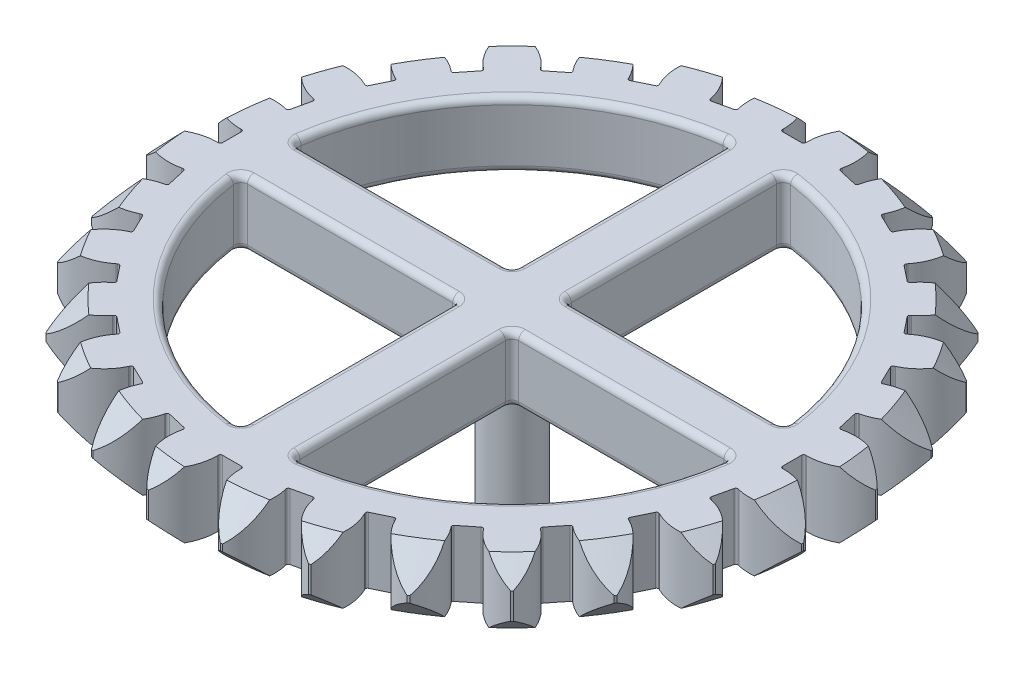
from build123d import *

# Parameters (mm, degrees)
SKETCH1_R             = 4
BOSS_EXTRUDE1_DEPTH   = 10
BOSS_EXTRUDE2_DEPTH   = 10
CUT_EXTRUDE2_REACH    = 78.425
FILLET1_R             = 1
SKETCH4_R             = 2
BOSS_EXTRUDE3_DEPTH   = 10
CUT_REVOLVE2_ANGLE    = 15
CIRPATTERN1_COUNT     = 14
MIRROR1_COPY_1_ANGLE  = 15
MIRROR1_COPY_2_ANGLE  = 15
MIRROR1_COPY_3_ANGLE  = 15
MIRROR1_COPY_4_ANGLE  = 15
MIRROR1_COPY_5_ANGLE  = 15
MIRROR1_COPY_6_ANGLE  = 15
MIRROR1_COPY_7_ANGLE  = 15
MIRROR1_COPY_8_ANGLE  = 15
MIRROR1_COPY_9_ANGLE  = 15
MIRROR1_COPY_10_ANGLE = 15
MIRROR1_COPY_11_ANGLE = 15
MIRROR1_COPY_12_ANGLE = 15
MIRROR1_COPY_13_ANGLE = 15


with BuildPart() as part:
    # Sketch1 → Boss-Extrude1 (new, symmetric)
    with BuildSketch(Plane(origin=(0, 0, 0), x_dir=(1, 0, 0), z_dir=(0, 1, 0))):
        Circle(SKETCH1_R)
        with BuildLine():
            Line((-1.322875656, 1.5), (1.322875656, 1.5))
            ThreePointArc((1.322875656, 1.5), (0, -2), (-1.322875656, 1.5))
        make_face(mode=Mode.SUBTRACT)
    extrude(amount=BOSS_EXTRUDE1_DEPTH, both=True)

    # Sketch2 → Boss-Extrude2 (add)
    with BuildSketch(Plane(origin=(0, 10, 0), x_dir=(1, 0, 0), z_dir=(0, 1, 0))):
        with BuildLine():
            Line((1.45, 42.5), (-1.45, 42.5))
            ThreePointArc((-1.45, 42.5), (-1.662132034, 42.587867966), (-1.75, 42.8))
            Line((-1.75, 42.8), (-1.75, 42.964374777))
            ThreePointArc((-1.75, 42.964374777), (-2.73252906, 46.805611766), (-5.438775402, 49.703317013))
            ThreePointArc((-5.438775402, 49.703317013), (-5.598223805, 49.685610495), (-5.757614575, 49.667392466))
            ThreePointArc((-5.757614575, 49.667392466), (-7.751209593, 46.240142276), (-7.854348956, 42.276579834))
            Line((-7.854348956, 42.276579834), (-7.817772127, 42.116326276))
            ThreePointArc((-7.817772127, 42.116326276), (-7.856233241, 41.889960373), (-8.04349422, 41.757091622))
            Line((-8.04349422, 41.757091622), (-10.870785166, 41.111780913))
            ThreePointArc((-10.870785166, 41.111780913), (-11.097151069, 41.150242027), (-11.23001982, 41.337503007))
            Line((-11.23001982, 41.337503007), (-11.266596649, 41.497756565))
            ThreePointArc((-11.266596649, 41.497756565), (-13.079247296, 45.024052439), (-16.36244247, 47.246909702))
            ThreePointArc((-16.36244247, 47.246909702), (-16.513953098, 47.194166515), (-16.665293716, 47.140937468))
            ThreePointArc((-16.665293716, 47.140937468), (-17.846270231, 43.35599897), (-17.064848058, 39.468860647))
            Line((-17.064848058, 39.468860647), (-16.993528515, 39.32076409))
            ThreePointArc((-16.993528515, 39.32076409), (-16.980654177, 39.091515249), (-17.133654054, 38.920308308))
            Line((-17.133654054, 38.920308308), (-19.746463771, 37.662045464))
            ThreePointArc((-19.746463771, 37.662045464), (-19.975712611, 37.649171125), (-20.146919553, 37.802171003))
            Line((-20.146919553, 37.802171003), (-20.218239096, 37.95026756))
            ThreePointArc((-20.218239096, 37.95026756), (-22.770117459, 40.984799119), (-26.465628349, 42.421345053))
            ThreePointArc((-26.465628349, 42.421345053), (-26.601603826, 42.336209961), (-26.737305441, 42.250639022))
            ThreePointArc((-26.737305441, 42.250639022), (-27.04644436, 38.297804837), (-25.419644423, 34.682007979))
            Line((-25.419644423, 34.682007979), (-25.317158425, 34.553494603))
            ThreePointArc((-25.317158425, 34.553494603), (-25.253594207, 34.332858319), (-25.364660929, 34.131898218))
            Line((-25.364660929, 34.131898218), (-27.631972229, 32.323777792))
            ThreePointArc((-27.631972229, 32.323777792), (-27.852608512, 32.260213574), (-28.053568614, 32.371280296))
            Line((-28.053568614, 32.371280296), (-28.156054611, 32.499793672))
            ThreePointArc((-28.156054611, 32.499793672), (-31.319198852, 34.890396833), (-35.241717111, 35.468597027))
            ThreePointArc((-35.241717111, 35.468597027), (-35.355339059, 35.355339059), (-35.468597027, 35.241717111))
            ThreePointArc((-35.468597027, 35.241717111), (-34.890396833, 31.319198852), (-32.499793672, 28.156054611))
            Line((-32.499793672, 28.156054611), (-32.371280296, 28.053568614))
            ThreePointArc((-32.371280296, 28.053568614), (-32.260213574, 27.852608512), (-32.323777792, 27.631972229))
            Line((-32.323777792, 27.631972229), (-34.131898218, 25.364660929))
            ThreePointArc((-34.131898218, 25.364660929), (-34.332858319, 25.253594207), (-34.553494603, 25.317158425))
            Line((-34.553494603, 25.317158425), (-34.682007979, 25.419644423))
            ThreePointArc((-34.682007979, 25.419644423), (-38.297804837, 27.04644436), (-42.250639022, 26.737305441))
            ThreePointArc((-42.250639022, 26.737305441), (-42.336209961, 26.601603826), (-42.421345053, 26.465628349))
            ThreePointArc((-42.421345053, 26.465628349), (-40.984799119, 22.770117459), (-37.95026756, 20.218239096))
            Line((-37.95026756, 20.218239096), (-37.802171003, 20.146919553))
            ThreePointArc((-37.802171003, 20.146919553), (-37.649171125, 19.975712611), (-37.662045464, 19.746463771))
            Line((-37.662045464, 19.746463771), (-38.920308308, 17.133654054))
            ThreePointArc((-38.920308308, 17.133654054), (-39.091515249, 16.980654177), (-39.32076409, 16.993528515))
            Line((-39.32076409, 16.993528515), (-39.468860647, 17.064848058))
            ThreePointArc((-39.468860647, 17.064848058), (-43.35599897, 17.846270231), (-47.140937468, 16.665293716))
            ThreePointArc((-47.140937468, 16.665293716), (-47.194166515, 16.513953098), (-47.246909702, 16.36244247))
            ThreePointArc((-47.246909702, 16.36244247), (-45.024052439, 13.079247296), (-41.497756565, 11.266596649))
            Line((-41.497756565, 11.266596649), (-41.337503007, 11.23001982))
            ThreePointArc((-41.337503007, 11.23001982), (-41.150242027, 11.097151069), (-41.111780913, 10.870785166))
            Line((-41.111780913, 10.870785166), (-41.757091622, 8.04349422))
            ThreePointArc((-41.757091622, 8.04349422), (-41.889960373, 7.856233241), (-42.116326276, 7.817772127))
            Line((-42.116326276, 7.817772127), (-42.276579834, 7.854348956))
            ThreePointArc((-42.276579834, 7.854348956), (-46.240142276, 7.751209593), (-49.667392466, 5.757614575))
            ThreePointArc((-49.667392466, 5.757614575), (-49.685610495, 5.598223805), (-49.703317013, 5.438775402))
            ThreePointArc((-49.703317013, 5.438775402), (-46.805611766, 2.73252906), (-42.964374777, 1.75))
            Line((-42.964374777, 1.75), (-42.8, 1.75))
            ThreePointArc((-42.8, 1.75), (-42.587867966, 1.662132034), (-42.5, 1.45))
            Line((-42.5, 1.45), (-42.5, -1.45))
            ThreePointArc((-42.5, -1.45), (-42.587867966, -1.662132034), (-42.8, -1.75))
            Line((-42.8, -1.75), (-42.964374777, -1.75))
            ThreePointArc((-42.964374777, -1.75), (-46.805611766, -2.73252906), (-49.703317013, -5.438775402))
            ThreePointArc((-49.703317013, -5.438775402), (-49.685610495, -5.598223805), (-49.667392466, -5.757614575))
            ThreePointArc((-49.667392466, -5.757614575), (-46.240142276, -7.751209593), (-42.276579834, -7.854348956))
            Line((-42.276579834, -7.854348956), (-42.116326276, -7.817772127))
            ThreePointArc((-42.116326276, -7.817772127), (-41.889960373, -7.856233241), (-41.757091622, -8.04349422))
            Line((-41.757091622, -8.04349422), (-41.111780913, -10.870785166))
            ThreePointArc((-41.111780913, -10.870785166), (-41.150242027, -11.097151069), (-41.337503007, -11.23001982))
            Line((-41.337503007, -11.23001982), (-41.497756565, -11.266596649))
            ThreePointArc((-41.497756565, -11.266596649), (-45.024052439, -13.079247296), (-47.246909702, -16.36244247))
            ThreePointArc((-47.246909702, -16.36244247), (-47.194166515, -16.513953098), (-47.140937468, -16.665293716))
            ThreePointArc((-47.140937468, -16.665293716), (-43.35599897, -17.846270231), (-39.468860647, -17.064848058))
            Line((-39.468860647, -17.064848058), (-39.32076409, -16.993528515))
            ThreePointArc((-39.32076409, -16.993528515), (-39.091515249, -16.980654177), (-38.920308308, -17.133654054))
            Line((-38.920308308, -17.133654054), (-37.662045464, -19.746463771))
            ThreePointArc((-37.662045464, -19.746463771), (-37.649171125, -19.975712611), (-37.802171003, -20.146919553))
            Line((-37.802171003, -20.146919553), (-37.95026756, -20.218239096))
            ThreePointArc((-37.95026756, -20.218239096), (-40.984799119, -22.770117459), (-42.421345053, -26.465628349))
            ThreePointArc((-42.421345053, -26.465628349), (-42.336209961, -26.601603826), (-42.250639022, -26.737305441))
            ThreePointArc((-42.250639022, -26.737305441), (-38.297804837, -27.04644436), (-34.682007979, -25.419644423))
            Line((-34.682007979, -25.419644423), (-34.553494603, -25.317158425))
            ThreePointArc((-34.553494603, -25.317158425), (-34.332858319, -25.253594207), (-34.131898218, -25.364660929))
            Line((-34.131898218, -25.364660929), (-32.323777792, -27.631972229))
            ThreePointArc((-32.323777792, -27.631972229), (-32.260213574, -27.852608512), (-32.371280296, -28.053568614))
            Line((-32.371280296, -28.053568614), (-32.499793672, -28.156054611))
            ThreePointArc((-32.499793672, -28.156054611), (-34.890396833, -31.319198852), (-35.468597027, -35.241717111))
            ThreePointArc((-35.468597027, -35.241717111), (-35.355339059, -35.355339059), (-35.241717111, -35.468597027))
            ThreePointArc((-35.241717111, -35.468597027), (-31.319198852, -34.890396833), (-28.156054611, -32.499793672))
            Line((-28.156054611, -32.499793672), (-28.053568614, -32.371280296))
            ThreePointArc((-28.053568614, -32.371280296), (-27.852608512, -32.260213574), (-27.631972229, -32.323777792))
            Line((-27.631972229, -32.323777792), (-25.364660929, -34.131898218))
            ThreePointArc((-25.364660929, -34.131898218), (-25.253594207, -34.332858319), (-25.317158425, -34.553494603))
            Line((-25.317158425, -34.553494603), (-25.419644423, -34.682007979))
            ThreePointArc((-25.419644423, -34.682007979), (-27.04644436, -38.297804837), (-26.737305441, -42.250639022))
            ThreePointArc((-26.737305441, -42.250639022), (-26.601603826, -42.336209961), (-26.465628349, -42.421345053))
            ThreePointArc((-26.465628349, -42.421345053), (-22.770117459, -40.984799119), (-20.218239096, -37.95026756))
            Line((-20.218239096, -37.95026756), (-20.146919553, -37.802171003))
            ThreePointArc((-20.146919553, -37.802171003), (-19.975712611, -37.649171125), (-19.746463771, -37.662045464))
            Line((-19.746463771, -37.662045464), (-17.133654054, -38.920308308))
            ThreePointArc((-17.133654054, -38.920308308), (-16.980654177, -39.091515249), (-16.993528515, -39.32076409))
            Line((-16.993528515, -39.32076409), (-17.064848058, -39.468860647))
            ThreePointArc((-17.064848058, -39.468860647), (-17.846270231, -43.35599897), (-16.665293716, -47.140937468))
            ThreePointArc((-16.665293716, -47.140937468), (-16.513953098, -47.194166515), (-16.36244247, -47.246909702))
            ThreePointArc((-16.36244247, -47.246909702), (-13.079247296, -45.024052439), (-11.266596649, -41.497756565))
            Line((-11.266596649, -41.497756565), (-11.23001982, -41.337503007))
            ThreePointArc((-11.23001982, -41.337503007), (-11.097151069, -41.150242027), (-10.870785166, -41.111780913))
            Line((-10.870785166, -41.111780913), (-8.04349422, -41.757091622))
            ThreePointArc((-8.04349422, -41.757091622), (-7.856233241, -41.889960373), (-7.817772127, -42.116326276))
            Line((-7.817772127, -42.116326276), (-7.854348956, -42.276579834))
            ThreePointArc((-7.854348956, -42.276579834), (-7.751209593, -46.240142276), (-5.757614575, -49.667392466))
            ThreePointArc((-5.757614575, -49.667392466), (-5.598223805, -49.685610495), (-5.438775402, -49.703317013))
            ThreePointArc((-5.438775402, -49.703317013), (-2.73252906, -46.805611766), (-1.75, -42.964374777))
            Line((-1.75, -42.964374777), (-1.75, -42.8))
            ThreePointArc((-1.75, -42.8), (-1.662132034, -42.587867966), (-1.45, -42.5))
            Line((-1.45, -42.5), (1.45, -42.5))
            ThreePointArc((1.45, -42.5), (1.662132034, -42.587867966), (1.75, -42.8))
            Line((1.75, -42.8), (1.75, -42.964374777))
            ThreePointArc((1.75, -42.964374777), (2.73252906, -46.805611766), (5.438775402, -49.703317013))
            ThreePointArc((5.438775402, -49.703317013), (5.598223805, -49.685610495), (5.757614575, -49.667392466))
            ThreePointArc((5.757614575, -49.667392466), (7.751209593, -46.240142276), (7.854348956, -42.276579834))
            Line((7.854348956, -42.276579834), (7.817772127, -42.116326276))
            ThreePointArc((7.817772127, -42.116326276), (7.856233241, -41.889960373), (8.04349422, -41.757091622))
            Line((8.04349422, -41.757091622), (10.870785166, -41.111780913))
            ThreePointArc((10.870785166, -41.111780913), (11.097151069, -41.150242027), (11.23001982, -41.337503007))
            Line((11.23001982, -41.337503007), (11.266596649, -41.497756565))
            ThreePointArc((11.266596649, -41.497756565), (13.079247296, -45.024052439), (16.36244247, -47.246909702))
            ThreePointArc((16.36244247, -47.246909702), (16.513953098, -47.194166515), (16.665293716, -47.140937468))
            ThreePointArc((16.665293716, -47.140937468), (17.846270231, -43.35599897), (17.064848058, -39.468860647))
            Line((17.064848058, -39.468860647), (16.993528515, -39.32076409))
            ThreePointArc((16.993528515, -39.32076409), (16.980654177, -39.091515249), (17.133654054, -38.920308308))
            Line((17.133654054, -38.920308308), (19.746463771, -37.662045464))
            ThreePointArc((19.746463771, -37.662045464), (19.975712611, -37.649171125), (20.146919553, -37.802171003))
            Line((20.146919553, -37.802171003), (20.218239096, -37.95026756))
            ThreePointArc((20.218239096, -37.95026756), (22.770117459, -40.984799119), (26.465628349, -42.421345053))
            ThreePointArc((26.465628349, -42.421345053), (26.601603826, -42.336209961), (26.737305441, -42.250639022))
            ThreePointArc((26.737305441, -42.250639022), (27.04644436, -38.297804837), (25.419644423, -34.682007979))
            Line((25.419644423, -34.682007979), (25.317158425, -34.553494603))
            ThreePointArc((25.317158425, -34.553494603), (25.253594207, -34.332858319), (25.364660929, -34.131898218))
            Line((25.364660929, -34.131898218), (27.631972229, -32.323777792))
            ThreePointArc((27.631972229, -32.323777792), (27.852608512, -32.260213574), (28.053568614, -32.371280296))
            Line((28.053568614, -32.371280296), (28.156054611, -32.499793672))
            ThreePointArc((28.156054611, -32.499793672), (31.319198852, -34.890396833), (35.241717111, -35.468597027))
            ThreePointArc((35.241717111, -35.468597027), (35.355339059, -35.355339059), (35.468597027, -35.241717111))
            ThreePointArc((35.468597027, -35.241717111), (34.890396833, -31.319198852), (32.499793672, -28.156054611))
            Line((32.499793672, -28.156054611), (32.371280296, -28.053568614))
            ThreePointArc((32.371280296, -28.053568614), (32.260213574, -27.852608512), (32.323777792, -27.631972229))
            Line((32.323777792, -27.631972229), (34.131898218, -25.364660929))
            ThreePointArc((34.131898218, -25.364660929), (34.332858319, -25.253594207), (34.553494603, -25.317158425))
            Line((34.553494603, -25.317158425), (34.682007979, -25.419644423))
            ThreePointArc((34.682007979, -25.419644423), (38.297804837, -27.04644436), (42.250639022, -26.737305441))
            ThreePointArc((42.250639022, -26.737305441), (42.336209961, -26.601603826), (42.421345053, -26.465628349))
            ThreePointArc((42.421345053, -26.465628349), (40.984799119, -22.770117459), (37.95026756, -20.218239096))
            Line((37.95026756, -20.218239096), (37.802171003, -20.146919553))
            ThreePointArc((37.802171003, -20.146919553), (37.649171125, -19.975712611), (37.662045464, -19.746463771))
            Line((37.662045464, -19.746463771), (38.920308308, -17.133654054))
            ThreePointArc((38.920308308, -17.133654054), (39.091515249, -16.980654177), (39.32076409, -16.993528515))
            Line((39.32076409, -16.993528515), (39.468860647, -17.064848058))
            ThreePointArc((39.468860647, -17.064848058), (43.35599897, -17.846270231), (47.140937468, -16.665293716))
            ThreePointArc((47.140937468, -16.665293716), (47.194166515, -16.513953098), (47.246909702, -16.36244247))
            ThreePointArc((47.246909702, -16.36244247), (45.024052439, -13.079247296), (41.497756565, -11.266596649))
            Line((41.497756565, -11.266596649), (41.337503007, -11.23001982))
            ThreePointArc((41.337503007, -11.23001982), (41.150242027, -11.097151069), (41.111780913, -10.870785166))
            Line((41.111780913, -10.870785166), (41.757091622, -8.04349422))
            ThreePointArc((41.757091622, -8.04349422), (41.889960373, -7.856233241), (42.116326276, -7.817772127))
            Line((42.116326276, -7.817772127), (42.276579834, -7.854348956))
            ThreePointArc((42.276579834, -7.854348956), (46.240142276, -7.751209593), (49.667392466, -5.757614575))
            ThreePointArc((49.667392466, -5.757614575), (49.685610495, -5.598223805), (49.703317013, -5.438775402))
            ThreePointArc((49.703317013, -5.438775402), (46.805611766, -2.73252906), (42.964374777, -1.75))
            Line((42.964374777, -1.75), (42.8, -1.75))
            ThreePointArc((42.8, -1.75), (42.587867966, -1.662132034), (42.5, -1.45))
            Line((42.5, -1.45), (42.5, 1.45))
            ThreePointArc((42.5, 1.45), (42.587867966, 1.662132034), (42.8, 1.75))
            Line((42.8, 1.75), (42.964374777, 1.75))
            ThreePointArc((42.964374777, 1.75), (46.805611766, 2.73252906), (49.703317013, 5.438775402))
            ThreePointArc((49.703317013, 5.438775402), (49.685610495, 5.598223805), (49.667392466, 5.757614575))
            ThreePointArc((49.667392466, 5.757614575), (46.240142276, 7.751209593), (42.276579834, 7.854348956))
            Line((42.276579834, 7.854348956), (42.116326276, 7.817772127))
            ThreePointArc((42.116326276, 7.817772127), (41.889960373, 7.856233241), (41.757091622, 8.04349422))
            Line((41.757091622, 8.04349422), (41.111780913, 10.870785166))
            ThreePointArc((41.111780913, 10.870785166), (41.150242027, 11.097151069), (41.337503007, 11.23001982))
            Line((41.337503007, 11.23001982), (41.497756565, 11.266596649))
            ThreePointArc((41.497756565, 11.266596649), (45.024052439, 13.079247296), (47.246909702, 16.36244247))
            ThreePointArc((47.246909702, 16.36244247), (47.194166515, 16.513953098), (47.140937468, 16.665293716))
            ThreePointArc((47.140937468, 16.665293716), (43.35599897, 17.846270231), (39.468860647, 17.064848058))
            Line((39.468860647, 17.064848058), (39.32076409, 16.993528515))
            ThreePointArc((39.32076409, 16.993528515), (39.091515249, 16.980654177), (38.920308308, 17.133654054))
            Line((38.920308308, 17.133654054), (37.662045464, 19.746463771))
            ThreePointArc((37.662045464, 19.746463771), (37.649171125, 19.975712611), (37.802171003, 20.146919553))
            Line((37.802171003, 20.146919553), (37.95026756, 20.218239096))
            ThreePointArc((37.95026756, 20.218239096), (40.984799119, 22.770117459), (42.421345053, 26.465628349))
            ThreePointArc((42.421345053, 26.465628349), (42.336209961, 26.601603826), (42.250639022, 26.737305441))
            ThreePointArc((42.250639022, 26.737305441), (38.297804837, 27.04644436), (34.682007979, 25.419644423))
            Line((34.682007979, 25.419644423), (34.553494603, 25.317158425))
            ThreePointArc((34.553494603, 25.317158425), (34.332858319, 25.253594207), (34.131898218, 25.364660929))
            Line((34.131898218, 25.364660929), (32.323777792, 27.631972229))
            ThreePointArc((32.323777792, 27.631972229), (32.260213574, 27.852608512), (32.371280296, 28.053568614))
            Line((32.371280296, 28.053568614), (32.499793672, 28.156054611))
            ThreePointArc((32.499793672, 28.156054611), (34.890396833, 31.319198852), (35.468597027, 35.241717111))
            ThreePointArc((35.468597027, 35.241717111), (35.355339059, 35.355339059), (35.241717111, 35.468597027))
            ThreePointArc((35.241717111, 35.468597027), (31.319198852, 34.890396833), (28.156054611, 32.499793672))
            Line((28.156054611, 32.499793672), (28.053568614, 32.371280296))
            ThreePointArc((28.053568614, 32.371280296), (27.852608512, 32.260213574), (27.631972229, 32.323777792))
            Line((27.631972229, 32.323777792), (25.364660929, 34.131898218))
            ThreePointArc((25.364660929, 34.131898218), (25.253594207, 34.332858319), (25.317158425, 34.553494603))
            Line((25.317158425, 34.553494603), (25.419644423, 34.682007979))
            ThreePointArc((25.419644423, 34.682007979), (27.04644436, 38.297804837), (26.737305441, 42.250639022))
            ThreePointArc((26.737305441, 42.250639022), (26.601603826, 42.336209961), (26.465628349, 42.421345053))
            ThreePointArc((26.465628349, 42.421345053), (22.770117459, 40.984799119), (20.218239096, 37.95026756))
            Line((20.218239096, 37.95026756), (20.146919553, 37.802171003))
            ThreePointArc((20.146919553, 37.802171003), (19.975712611, 37.649171125), (19.746463771, 37.662045464))
            Line((19.746463771, 37.662045464), (17.133654054, 38.920308308))
            ThreePointArc((17.133654054, 38.920308308), (16.980654177, 39.091515249), (16.993528515, 39.32076409))
            Line((16.993528515, 39.32076409), (17.064848058, 39.468860647))
            ThreePointArc((17.064848058, 39.468860647), (17.846270231, 43.35599897), (16.665293716, 47.140937468))
            ThreePointArc((16.665293716, 47.140937468), (16.513953098, 47.194166515), (16.36244247, 47.246909702))
            ThreePointArc((16.36244247, 47.246909702), (13.079247296, 45.024052439), (11.266596649, 41.497756565))
            Line((11.266596649, 41.497756565), (11.23001982, 41.337503007))
            ThreePointArc((11.23001982, 41.337503007), (11.097151069, 41.150242027), (10.870785166, 41.111780913))
            Line((10.870785166, 41.111780913), (8.04349422, 41.757091622))
            ThreePointArc((8.04349422, 41.757091622), (7.856233241, 41.889960373), (7.817772127, 42.116326276))
            Line((7.817772127, 42.116326276), (7.854348956, 42.276579834))
            ThreePointArc((7.854348956, 42.276579834), (7.751209593, 46.240142276), (5.757614575, 49.667392466))
            ThreePointArc((5.757614575, 49.667392466), (5.598223805, 49.685610495), (5.438775402, 49.703317013))
            ThreePointArc((5.438775402, 49.703317013), (2.73252906, 46.805611766), (1.75, 42.964374777))
            Line((1.75, 42.964374777), (1.75, 42.8))
            ThreePointArc((1.75, 42.8), (1.662132034, 42.587867966), (1.45, 42.5))
        make_face()
    extrude(amount=BOSS_EXTRUDE2_DEPTH)

    # Sketch3 → Cut-Extrude2 (cut, up to next)
    with BuildSketch(Plane(origin=(0, 20, 0), x_dir=(1, 0, 0), z_dir=(0, 1, 0)), mode=Mode.PRIVATE) as cut_extrude2_sk1:
        with BuildLine():
            Line((-37.286056375, 4), (-4, 4))
            Line((-4, 4), (-4, 37.286056375))
            ThreePointArc((-4, 37.286056375), (-26.516504294, 26.516504294), (-37.286056375, 4))
        make_face()
    cut_extrude2_tool1 = extrude(cut_extrude2_sk1.sketch, amount=-CUT_EXTRUDE2_REACH, mode=Mode.PRIVATE) & part.part
    # Sketch3 → Cut-Extrude2 (cut, up to next)
    with BuildSketch(Plane(origin=(0, 20, 0), x_dir=(1, 0, 0), z_dir=(0, 1, 0)), mode=Mode.PRIVATE) as cut_extrude2_sk2:
        with BuildLine():
            Line((-4, -37.286056375), (-4, -4))
            Line((-4, -4), (-37.286056375, -4))
            ThreePointArc((-37.286056375, -4), (-26.516504294, -26.516504294), (-4, -37.286056375))
        make_face()
    cut_extrude2_tool2 = extrude(cut_extrude2_sk2.sketch, amount=-CUT_EXTRUDE2_REACH, mode=Mode.PRIVATE) & part.part
    # Sketch3 → Cut-Extrude2 (cut, up to next)
    with BuildSketch(Plane(origin=(0, 20, 0), x_dir=(1, 0, 0), z_dir=(0, 1, 0)), mode=Mode.PRIVATE) as cut_extrude2_sk3:
        with BuildLine():
            ThreePointArc((37.286056375, 4), (26.516504294, 26.516504294), (4, 37.286056375))
            Line((4, 37.286056375), (4, 4))
            Line((4, 4), (37.286056375, 4))
        make_face()
    cut_extrude2_tool3 = extrude(cut_extrude2_sk3.sketch, amount=-CUT_EXTRUDE2_REACH, mode=Mode.PRIVATE) & part.part
    # Sketch3 → Cut-Extrude2 (cut, up to next)
    with BuildSketch(Plane(origin=(0, 20, 0), x_dir=(1, 0, 0), z_dir=(0, 1, 0)), mode=Mode.PRIVATE) as cut_extrude2_sk4:
        with BuildLine():
            Line((4, -4), (4, -37.286056375))
            ThreePointArc((4, -37.286056375), (26.516504294, -26.516504294), (37.286056375, -4))
            Line((37.286056375, -4), (4, -4))
        make_face()
    cut_extrude2_tool4 = extrude(cut_extrude2_sk4.sketch, amount=-CUT_EXTRUDE2_REACH, mode=Mode.PRIVATE) & part.part
    add(cut_extrude2_tool1.solids().sort_by_distance((-17.671754, 20, -17.671754))[0], mode=Mode.SUBTRACT)
    add(cut_extrude2_tool2.solids().sort_by_distance((-17.671754, 20, 17.671754))[0], mode=Mode.SUBTRACT)
    add(cut_extrude2_tool3.solids().sort_by_distance((17.671754, 20, -17.671754))[0], mode=Mode.SUBTRACT)
    add(cut_extrude2_tool4.solids().sort_by_distance((17.671754, 20, 17.671754))[0], mode=Mode.SUBTRACT)

    # Fillet1
    fillet1_edges = [part.edges().sort_by_distance(p)[0] for p in [
        (4, 10, -20.643028188),
        (4, 20, -20.643028188),
        (4, 15, -37.286056375),
        (26.516504294, 20, -26.516504294),
        (26.516504294, 10, -26.516504294),
        (37.286056375, 15, -4),
        (20.643028188, 20, -4),
        (20.643028188, 10, -4),
        (-4, 10, 20.643028188),
        (-4, 20, 20.643028188),
        (-4, 15, 37.286056375),
        (-26.516504294, 20, 26.516504294),
        (-26.516504294, 10, 26.516504294),
        (-37.286056375, 15, 4),
        (-20.643028188, 20, 4),
        (-20.643028188, 10, 4),
        (20.643028188, 10, 4),
        (20.643028188, 20, 4),
        (37.286056375, 15, 4),
        (26.516504294, 20, 26.516504294),
        (26.516504294, 10, 26.516504294),
        (4, 15, 37.286056375),
        (4, 20, 20.643028188),
        (4, 10, 20.643028188),
        (-20.643028188, 10, -4),
        (-20.643028188, 20, -4),
        (-37.286056375, 15, -4),
        (-26.516504294, 20, -26.516504294),
        (-26.516504294, 10, -26.516504294),
        (-4, 15, -37.286056375),
        (-4, 20, -20.643028188),
        (-4, 10, -20.643028188),
        (4, 15, -4),
        (-4, 15, 4),
        (4, 15, 4),
        (-4, 15, -4),
    ]]
    fillet(fillet1_edges, radius=FILLET1_R)

    # Sketch4 → Boss-Extrude3 (add)
    with BuildSketch(Plane.XZ.offset(-10)):
        Circle(SKETCH4_R)
    extrude(amount=BOSS_EXTRUDE3_DEPTH)

    # Sketch5 → Cut-Revolve1 (revolve, cut)
    with BuildSketch(Plane.XY):
        Polygon((47, 20), (50, 17), (50, 20), align=None)
    cut_revolve1 = revolve(axis=Axis((0, 0, 0), (0, 1, 0)), mode=Mode.SUBTRACT)

    # Sketch6 → Cut-Revolve2 (revolve, cut)
    with BuildSketch(Plane(origin=(0, 0, 0), x_dir=(0, 0, -1), z_dir=(1, 0, 0))):
        Polygon((45.5, 20), (50, 20), (50, 15.5), align=None)
    cut_revolve2 = revolve(axis=Axis((0, 0, 0), (0, 1, 0)), revolution_arc=CUT_REVOLVE2_ANGLE, mode=Mode.SUBTRACT)

    # CirPattern1: Cut-Revolve2 ×14 about axis
    cirpattern1_axis = Axis((0, -10, 0), (0, 1, 0))
    for i in range(1, CIRPATTERN1_COUNT):
        add(cut_revolve2.rotate(cirpattern1_axis, i * 360 / CIRPATTERN1_COUNT), mode=Mode.SUBTRACT)

    # Mirror1: Cut-Revolve1, Cut-Revolve2 across plane
    add(cut_revolve1.mirror(Plane(origin=(0, 15, 0), x_dir=(0, 0, 1), z_dir=(0, -1, 0))), mode=Mode.SUBTRACT)
    add(cut_revolve2.mirror(Plane(origin=(0, 15, 0), x_dir=(0, 0, 1), z_dir=(0, -1, 0))), mode=Mode.SUBTRACT)

    # Mirror1 copy 1 sketch → Mirror1 copy 1 (revolve, cut)
    with BuildSketch(Plane(origin=(0, 30, 0), x_dir=(-0.4338837391175581, 0, -0.9009688679024191), z_dir=(0.9009688679024191, 0, -0.4338837391175581))):
        Polygon((45.5, -20), (50, -20), (50, -15.5), align=None)
    revolve(axis=Axis((0, 30, 0), (0, 1, 0)), revolution_arc=MIRROR1_COPY_1_ANGLE, mode=Mode.SUBTRACT)

    # Mirror1 copy 2 sketch → Mirror1 copy 2 (revolve, cut)
    with BuildSketch(Plane(origin=(0, 30, 0), x_dir=(-0.7818314824680298, 0, -0.6234898018587336), z_dir=(0.6234898018587336, 0, -0.7818314824680298))):
        Polygon((45.5, -20), (50, -20), (50, -15.5), align=None)
    revolve(axis=Axis((0, 30, 0), (0, 1, 0)), revolution_arc=MIRROR1_COPY_2_ANGLE, mode=Mode.SUBTRACT)

    # Mirror1 copy 3 sketch → Mirror1 copy 3 (revolve, cut)
    with BuildSketch(Plane(origin=(0, 30, 0), x_dir=(-0.9749279121818236, 0, -0.22252093395631445), z_dir=(0.22252093395631445, 0, -0.9749279121818236))):
        Polygon((45.5, -20), (50, -20), (50, -15.5), align=None)
    revolve(axis=Axis((0, 30, 0), (0, 1, 0)), revolution_arc=MIRROR1_COPY_3_ANGLE, mode=Mode.SUBTRACT)

    # Mirror1 copy 4 sketch → Mirror1 copy 4 (revolve, cut)
    with BuildSketch(Plane(origin=(0, 30, 0), x_dir=(-0.9749279121818236, 0, 0.22252093395631434), z_dir=(-0.22252093395631434, 0, -0.9749279121818236))):
        Polygon((45.5, -20), (50, -20), (50, -15.5), align=None)
    revolve(axis=Axis((0, 30, 0), (0, 1, 0)), revolution_arc=MIRROR1_COPY_4_ANGLE, mode=Mode.SUBTRACT)

    # Mirror1 copy 5 sketch → Mirror1 copy 5 (revolve, cut)
    with BuildSketch(Plane(origin=(0, 30, 0), x_dir=(-0.7818314824680296, 0, 0.6234898018587338), z_dir=(-0.6234898018587338, 0, -0.7818314824680296))):
        Polygon((45.5, -20), (50, -20), (50, -15.5), align=None)
    revolve(axis=Axis((0, 30, 0), (0, 1, 0)), revolution_arc=MIRROR1_COPY_5_ANGLE, mode=Mode.SUBTRACT)

    # Mirror1 copy 6 sketch → Mirror1 copy 6 (revolve, cut)
    with BuildSketch(Plane(origin=(0, 30, 0), x_dir=(-0.43388373911755823, 0, 0.900968867902419), z_dir=(-0.900968867902419, 0, -0.43388373911755823))):
        Polygon((45.5, -20), (50, -20), (50, -15.5), align=None)
    revolve(axis=Axis((0, 30, 0), (0, 1, 0)), revolution_arc=MIRROR1_COPY_6_ANGLE, mode=Mode.SUBTRACT)

    # Mirror1 copy 7 sketch → Mirror1 copy 7 (revolve, cut)
    with BuildSketch(Plane(origin=(0, 30, 0), x_dir=(0, 0, 1), z_dir=(-1, 0, 0))):
        Polygon((45.5, -20), (50, -20), (50, -15.5), align=None)
    revolve(axis=Axis((0, 30, 0), (0, 1, 0)), revolution_arc=MIRROR1_COPY_7_ANGLE, mode=Mode.SUBTRACT)

    # Mirror1 copy 8 sketch → Mirror1 copy 8 (revolve, cut)
    with BuildSketch(Plane(origin=(0, 30, 0), x_dir=(0.433883739117558, 0, 0.9009688679024191), z_dir=(-0.9009688679024191, 0, 0.433883739117558))):
        Polygon((45.5, -20), (50, -20), (50, -15.5), align=None)
    revolve(axis=Axis((0, 30, 0), (0, 1, 0)), revolution_arc=MIRROR1_COPY_8_ANGLE, mode=Mode.SUBTRACT)

    # Mirror1 copy 9 sketch → Mirror1 copy 9 (revolve, cut)
    with BuildSketch(Plane(origin=(0, 30, 0), x_dir=(0.7818314824680297, 0, 0.6234898018587337), z_dir=(-0.6234898018587337, 0, 0.7818314824680297))):
        Polygon((45.5, -20), (50, -20), (50, -15.5), align=None)
    revolve(axis=Axis((0, 30, 0), (0, 1, 0)), revolution_arc=MIRROR1_COPY_9_ANGLE, mode=Mode.SUBTRACT)

    # Mirror1 copy 10 sketch → Mirror1 copy 10 (revolve, cut)
    with BuildSketch(Plane(origin=(0, 30, 0), x_dir=(0.9749279121818237, 0, 0.2225209339563137), z_dir=(-0.2225209339563137, 0, 0.9749279121818237))):
        Polygon((45.5, -20), (50, -20), (50, -15.5), align=None)
    revolve(axis=Axis((0, 30, 0), (0, 1, 0)), revolution_arc=MIRROR1_COPY_10_ANGLE, mode=Mode.SUBTRACT)

    # Mirror1 copy 11 sketch → Mirror1 copy 11 (revolve, cut)
    with BuildSketch(Plane(origin=(0, 30, 0), x_dir=(0.9749279121818234, 0, -0.2225209339563151), z_dir=(0.2225209339563151, 0, 0.9749279121818234))):
        Polygon((45.5, -20), (50, -20), (50, -15.5), align=None)
    revolve(axis=Axis((0, 30, 0), (0, 1, 0)), revolution_arc=MIRROR1_COPY_11_ANGLE, mode=Mode.SUBTRACT)

    # Mirror1 copy 12 sketch → Mirror1 copy 12 (revolve, cut)
    with BuildSketch(Plane(origin=(0, 30, 0), x_dir=(0.7818314824680299, 0, -0.6234898018587334), z_dir=(0.6234898018587334, 0, 0.7818314824680299))):
        Polygon((45.5, -20), (50, -20), (50, -15.5), align=None)
    revolve(axis=Axis((0, 30, 0), (0, 1, 0)), revolution_arc=MIRROR1_COPY_12_ANGLE, mode=Mode.SUBTRACT)

    # Mirror1 copy 13 sketch → Mirror1 copy 13 (revolve, cut)
    with BuildSketch(Plane(origin=(0, 30, 0), x_dir=(0.43388373911755834, 0, -0.900968867902419), z_dir=(0.900968867902419, 0, 0.43388373911755834))):
        Polygon((45.5, -20), (50, -20), (50, -15.5), align=None)
    revolve(axis=Axis((0, 30, 0), (0, 1, 0)), revolution_arc=MIRROR1_COPY_13_ANGLE, mode=Mode.SUBTRACT)


solid = part.part
